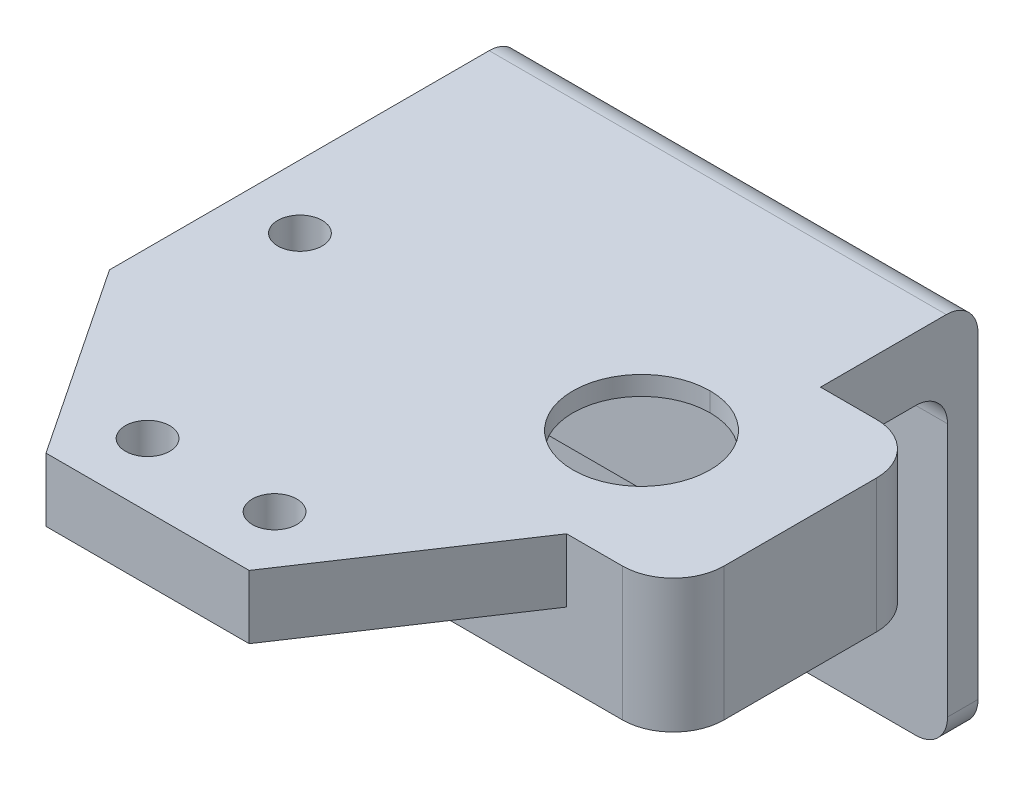
from build123d import *

# Parameters (mm, degrees)
SKETCH1_R           = 1.75
SKETCH1_W           = 7.2
SKETCH1_H           = 5.4
BOSS_EXTRUDE1_DEPTH = 5
FILLET5_RADIUS      = 10
FILLET5_LENGTH      = 5
FILLET2_R           = 5.4
FILLET6_R           = 5.4
SKETCH3_W           = 35
SKETCH3_H           = 20
SKETCH3_W_2         = 23
SKETCH3_H_2         = 13
BOSS_EXTRUDE4_DEPTH = 5.5
SKETCH5_W           = 23
SKETCH5_H           = 13
CUT_EXTRUDE1_DEPTH  = 3.5
CUT_EXTRUDE2_DEPTH  = 76.201396264
FILLET9_R           = 4
SKETCH9_R           = 0.875
CUT_EXTRUDE4_DEPTH  = 7
SKETCH10_W          = 36
SKETCH10_H          = 2.4
BOSS_EXTRUDE5_DEPTH = 30
SKETCH11_R          = 3.25
SKETCH11_R_2        = 0.875
CUT_EXTRUDE5_DEPTH  = 30
FILLET10_R          = 2.5


with BuildPart() as part:
    # Sketch1 → Boss-Extrude1 (new body)
    # profile 1 of 4: a face of its own
    with BuildSketch(Plane(origin=(0, 0, 0), x_dir=(1, 0, 0), z_dir=(0, 1, 0))):
        with BuildLine():
            Line((0, 15), (10, 0))
            Line((10, 0), (26, 0))
            Line((26, 0), (36, 15))
            Line((36, 15), (60, 15))
            Line((60, 15), (60, 25))
            Line((60, 25), (44.5, 25))
            Line((44.5, 25), (44.5, 19.6))
            Line((44.5, 19.6), (37.3, 19.6))
            Line((37.3, 19.6), (26.5, 19.6))
            Line((26.5, 19.6), (26.5, 25))
            Line((26.5, 25), (6.75, 25))
            ThreePointArc((6.75, 25), (5, 23.25), (3.25, 25))
            Line((3.25, 25), (0, 25))
            Line((0, 25), (0, 15))
        make_face()
        with Locations(Location((13, 5, 0), (0, 0, 270))):
            Circle(SKETCH1_R, mode=Mode.SUBTRACT)
        with Locations(Location((23, 5, 0), (0, 0, 270))):
            Circle(SKETCH1_R, mode=Mode.SUBTRACT)
    # profile 2 of 4: a face of its own
    with BuildSketch(Plane(origin=(0, 0, 0), x_dir=(1, 0, 0), z_dir=(0, 1, 0))):
        with BuildLine():
            Line((0, 45), (0, 25))
            Line((0, 25), (3.25, 25))
            ThreePointArc((3.25, 25), (5, 26.75), (6.75, 25))
            Line((6.75, 25), (26.5, 25))
            Line((26.5, 25), (26.5, 30.4))
            Line((26.5, 30.4), (37.3, 30.4))
            Line((37.3, 30.4), (44.5, 30.4))
            Line((44.5, 30.4), (44.5, 25))
            Line((44.5, 25), (60, 25))
            Line((60, 25), (60, 35))
            Line((60, 35), (36, 35))
            Line((36, 35), (36, 45))
            Line((36, 45), (26, 45))
            Line((26, 45), (0, 45))
        make_face()
    # profile 3 of 4: a face of its own
    with BuildSketch(Plane(origin=(0, 0, 0), x_dir=(1, 0, 0), z_dir=(0, 1, 0))):
        with Locations((40.9, 27.7)):
            Rectangle(SKETCH1_W, SKETCH1_H)
    # profile 4 of 4: a face of its own
    with BuildSketch(Plane(origin=(0, 0, 0), x_dir=(1, 0, 0), z_dir=(0, 1, 0))):
        with Locations((40.9, 22.3)):
            Rectangle(SKETCH1_W, SKETCH1_H)
    extrude(amount=BOSS_EXTRUDE1_DEPTH)

    # Fillet5: full round fillet: the end face becomes a half cylinder, R = half its width
    fillet5_face = Plane((60, 2.5, -25), x_dir=(0, -1, 0), z_dir=(1, 0, 0))  # on the end face: x along it, z out of the body
    fillet5_slab = fillet5_face.offset(-FILLET5_RADIUS / 2) * Box(FILLET5_LENGTH, 2 * FILLET5_RADIUS, FILLET5_RADIUS, mode=Mode.PRIVATE)  # the body's end, R deep
    fillet5_round = Plane((50, 2.5, -25), x_dir=(1, 0, 0), z_dir=(0, -1, 0)) * Cylinder(FILLET5_RADIUS, FILLET5_LENGTH, mode=Mode.PRIVATE)  # its axis R under the face
    add(fillet5_slab - fillet5_round, mode=Mode.SUBTRACT)

    # Fillet2
    fillet2_edges = [part.edges().sort_by_distance(p)[0] for p in [
        (26.5, 2.5, -30.4),
        (26.5, 2.5, -19.6),
    ]]
    fillet(fillet2_edges, radius=FILLET2_R - 0.0001)  # a hair under: the kernel refuses the full size

    # Fillet6
    fillet6_edges = [part.edges().sort_by_distance(p)[0] for p in [
        (37.3, 2.5, -19.6),
        (37.3, 2.5, -30.4),
    ]]
    fillet(fillet6_edges, radius=FILLET6_R - 0.0001)  # a hair under: the kernel refuses the full size

    # Sketch3 → Boss-Extrude4 (add)
    with BuildSketch(Plane.XZ):
        with Locations((26.9, -25)):
            Rectangle(SKETCH3_W, SKETCH3_H)
        with Locations((26.9, -25)):
            Rectangle(SKETCH3_W_2, SKETCH3_H_2, mode=Mode.SUBTRACT)
    extrude(amount=BOSS_EXTRUDE4_DEPTH)

    # Sketch5 → Cut-Extrude1 (cut)
    with BuildSketch(Plane.XZ):
        with Locations((26.9, -25)):
            Rectangle(SKETCH5_W, SKETCH5_H)
    extrude(amount=-CUT_EXTRUDE1_DEPTH, mode=Mode.SUBTRACT)

    # Sketch6 → Cut-Extrude2 (cut, through all)
    with BuildSketch(Plane.XZ):
        with BuildLine():
            Line((44.4, -15), (44.4, -35))
            Line((44.4, -35), (50, -35))
            ThreePointArc((50, -35), (60, -25), (50, -15))
            Line((50, -15), (44.4, -15))
        make_face()
    extrude(amount=-CUT_EXTRUDE2_DEPTH, mode=Mode.SUBTRACT)

    # Fillet9
    fillet9_edges = [part.edges().sort_by_distance(p)[0] for p in [
        (44.4, -0.25, -35),
        (44.4, -0.25, -15),
    ]]
    fillet(fillet9_edges, radius=FILLET9_R)

    # Sketch9 → Cut-Extrude4 (cut)
    with BuildSketch(Plane.XZ.offset(5.5)):
        with Locations(Location((13.1, -25, 0), (0, 0, 270))):
            Circle(SKETCH9_R)
        with Locations(Location((40.7, -25, 0), (0, 0, 270))):
            Circle(SKETCH9_R)
    extrude(amount=-CUT_EXTRUDE4_DEPTH, mode=Mode.SUBTRACT)

    # Sketch10 → Boss-Extrude5 (add)
    with BuildSketch(Plane(origin=(0, 5, 0), x_dir=(1, 0, 0), z_dir=(0, 1, 0))):
        with Locations((18, 46.2)):
            Rectangle(SKETCH10_W, SKETCH10_H)
    extrude(amount=-BOSS_EXTRUDE5_DEPTH)

    # Sketch11 → Cut-Extrude5 (cut)
    with BuildSketch(Plane(origin=(0, 0, -47.4), x_dir=(-1, 0, 0), z_dir=(0, 0, -1))):
        with Locations((-18, -10)):
            Circle(SKETCH11_R)
        with Locations((-24.5, -10)):
            Circle(SKETCH11_R_2)
        with Locations((-11.5, -10)):
            Circle(SKETCH11_R_2)
    extrude(amount=-CUT_EXTRUDE5_DEPTH, mode=Mode.SUBTRACT)

    # Fillet10
    fillet10_edges = [part.edges().sort_by_distance(p)[0] for p in [
        (0, -25, -46.2),
        (36, -25, -46.2),
        (18, 5, -47.4),
        (18, 0, -45),
    ]]
    fillet(fillet10_edges, radius=FILLET10_R)


solid = part.part
